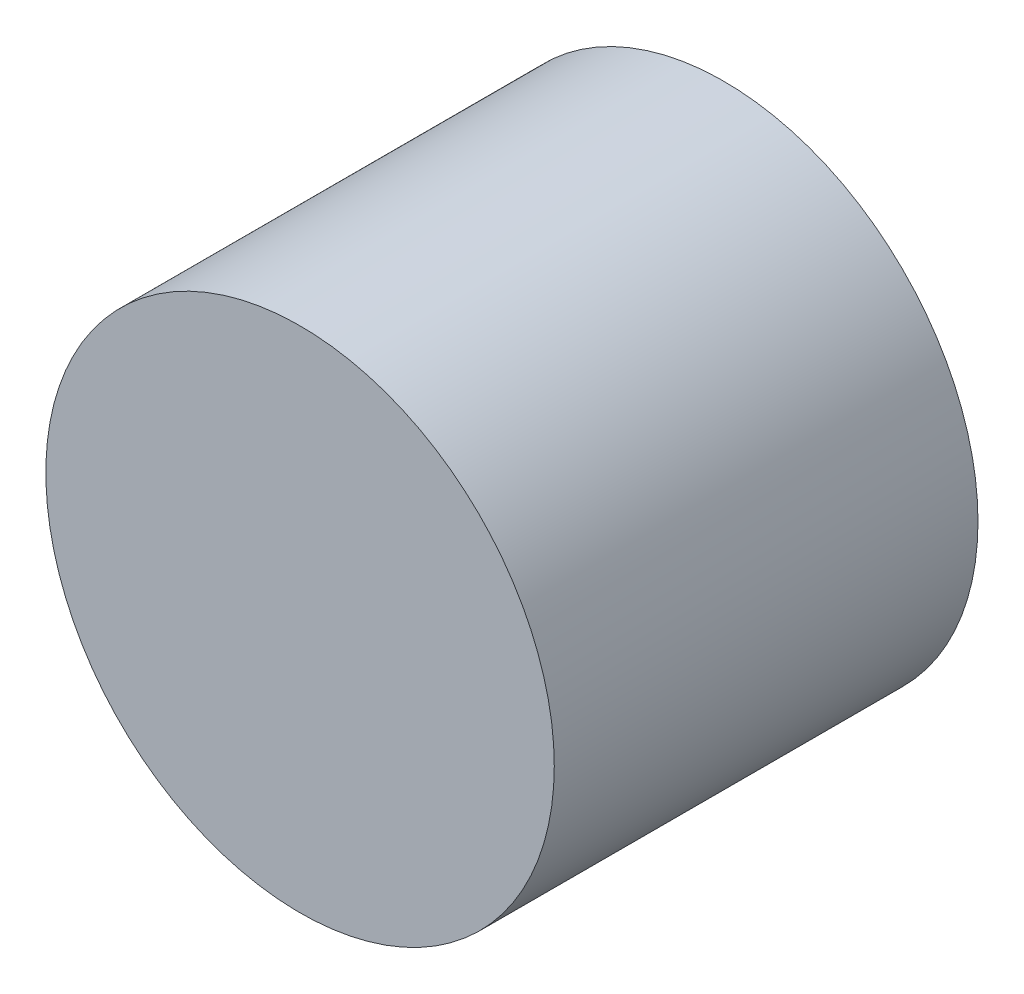
from build123d import *

# Parameters (mm, degrees)
SKETCH1_R           = 6
BOSS_EXTRUDE3_DEPTH = 10
CUT_EXTRUDE1_DEPTH  = 8
SKETCH4_R           = 4.5
CUT_EXTRUDE2_DEPTH  = 3


with BuildPart() as part:
    # Sketch1 → Boss-Extrude3 (new body)
    with BuildSketch(Plane.XY):
        with Locations((-68.390472542, -10.463565456)):
            Circle(SKETCH1_R)
    extrude(amount=BOSS_EXTRUDE3_DEPTH)

    # Sketch3 → Cut-Extrude1 (cut)
    with BuildSketch(Plane(origin=(0, 0, 0), x_dir=(-1, 0, 0), z_dir=(0, 0, -1))):
        with BuildLine():
            Line((70.988548754, -11.963565456), (65.792396331, -11.963565456))
            ThreePointArc((65.792396331, -11.963565456), (68.390472542, -7.463565456), (70.988548754, -11.963565456))
        make_face()
    extrude(amount=-CUT_EXTRUDE1_DEPTH, mode=Mode.SUBTRACT)

    # Sketch4 → Cut-Extrude2 (cut)
    with BuildSketch(Plane(origin=(0, 0, 0), x_dir=(-1, 0, 0), z_dir=(0, 0, -1))):
        with Locations((68.390472542, -10.463565456)):
            Circle(SKETCH4_R)
    extrude(amount=-CUT_EXTRUDE2_DEPTH, mode=Mode.SUBTRACT)


solid = part.part
